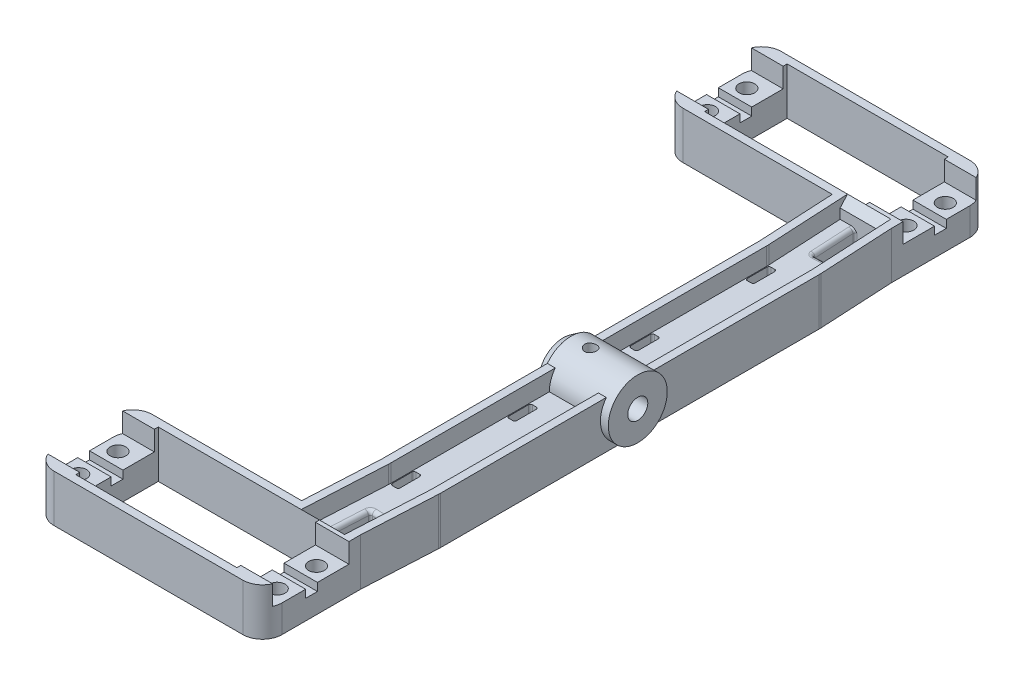
from build123d import *

# Parameters (mm, degrees)
BOSS_EXTRUDE1_DEPTH      = 25
CUT_EXTRUDE2_REACH       = 66.288
SKETCH4_W                = 8
SKETCH4_H                = 18.999999999999968
CUT_EXTRUDE3_DEPTH       = 5
F_4_0MM_DOWEL_HOLE1_D    = 4
CUT_EXTRUDE4_DEPTH       = 2
FILLET2_R                = 5
BOSS_EXTRUDE2_DEPTH      = 12
FILLET9_START            = -1
FILLET9_DEPTH            = 14
FILLET9_2_DEPTH          = 12
SHELL1_T                 = -2
SHELL1_THICKNESS_2_DEPTH = 5.5
BOSS_EXTRUDE3_DEPTH      = 2
BOSS_EXTRUDE3_DEPTH_BACK = 17
SKETCH13_R               = 7.500000000000028
FILLET5_R                = 5
CUT_EXTRUDE5_DEPTH       = 195.0238387415321
CUT_EXTRUDE5_DEPTH_BACK  = 195.0238387415321
CUT_EXTRUDE6_REACH       = 196.024
SKETCH19_W               = 2.0000000000000018
SKETCH19_H               = 6.000000000000028
SKETCH19_W_2             = 2.0000000000000036
FILLET10_R               = 0.5
LPATTERN2_COUNT          = 2
LPATTERN2_PITCH          = 29.657004096578483
FILLET10_OF_LPATTERN2_R  = 0.5
MIRROR4_DEPTH            = 7.5
FILLET8_R                = 0.5
FILLET7_R                = 1
CHAMFER3_SIZE2           = 1.349017034
CHAMFER3_SIZE            = 2
M3_CLEARANCE_HOLE1_D     = 3
M3_CLEARANCE_HOLE1_DEPTH = 4
CHAMFER4_SIZE            = 2


with BuildPart() as part:
    # Sketch1 → Boss-Extrude1 (new body)
    with BuildSketch(Plane.XY):
        Polygon((0, 0), (-57.99999999999999, -7.1e-15), (-57.99999999999999, 11.999999999999993), (0, 12), align=None)
    extrude(amount=BOSS_EXTRUDE1_DEPTH)

    # Sketch2 → Cut-Extrude2 (cut, up to next)
    with BuildSketch(Plane(origin=(-1.44e-15, 12, 0), x_dir=(1, 1.4e-16, 0), z_dir=(-1.4e-16, 1, 0)), mode=Mode.PRIVATE) as cut_extrude2_sk1:
        Polygon((-49.49999999999999, -2.0000000000000027), (-8.499999999999995, -1.9999999999999978), (-8.499999999999991, -23), (-49.49999999999999, -23.000000000000007), align=None)
    cut_extrude2_tool1 = extrude(cut_extrude2_sk1.sketch, amount=-CUT_EXTRUDE2_REACH, mode=Mode.PRIVATE) & part.part
    add(cut_extrude2_tool1.solids().sort_by_distance((-29, 12, 12.5))[0], mode=Mode.SUBTRACT)

    # Sketch4 → Cut-Extrude3 (cut)
    with BuildSketch(Plane(origin=(-1.44e-15, 12, 0), x_dir=(1, 1.4e-16, 0), z_dir=(-1.4e-16, 1, 0))):
        with Locations((-53.49999999999999, -12.500000000000023)):
            Rectangle(SKETCH4_W, SKETCH4_H)
        Polygon((-57.49999999999999, -22.000000000000007), (-57.49999999999999, -3.0000000000000386), (-57.99999999999999, -3.000000000000041), (-57.99999999999999, -21.999999999999957), align=None)
        Polygon((-8.499999999999993, -3.000000000000039), (-49.49999999999999, -3.0000000000000386), (-49.49999999999999, -22.000000000000007), (-8.499999999999993, -22.000000000000007), align=None)
        Polygon((-0.4999999999999929, -3.000000000000039), (-8.499999999999993, -3.000000000000039), (-8.499999999999991, -22.000000000000007), (-0.5, -22.000000000000007), align=None)
        Polygon((1.22e-15, -3.0000000000000155), (-0.4999999999999935, -3.000000000000039), (-0.499999999999997, -22.000000000000007), (1.22e-15, -22), align=None)
    extrude(amount=-CUT_EXTRUDE3_DEPTH, mode=Mode.SUBTRACT)

    # Ø4.0mm Dowel Hole1 (through all)
    with Locations(Plane(origin=(-8.6e-16, 7, 0), x_dir=(1, 1.2e-16, 0), z_dir=(-1.2e-16, 1, 0))):
        with Locations((-54.25, -7.5), (-3.75, -17.5), (-54.25, -17.5), (-3.75, -7.5)):
            Hole(F_4_0MM_DOWEL_HOLE1_D / 2)

    # Sketch8 → Cut-Extrude4 (cut)
    with BuildSketch(Plane(origin=(-8.6e-16, 7, 0), x_dir=(1, 1.2e-16, 0), z_dir=(-1.2e-16, 1, 0))):
        Polygon((-49.49999999999999, -11.000000000000021), (-57.999999999999986, -11.000000000000025), (-57.999999999999986, -14.000000000000018), (-49.49999999999999, -14.000000000000021), align=None)
        Polygon((-8.499999999999993, -11.000000000000021), (1.73e-15, -11.000000000000016), (1.73e-15, -14.000000000000027), (-8.499999999999993, -14.000000000000021), align=None)
    extrude(amount=-CUT_EXTRUDE4_DEPTH, mode=Mode.SUBTRACT)

    # Fillet2
    fillet2_edges = [part.edges().sort_by_distance(p)[0] for p in [
        (-57.99999999999999, 5.999999999999993, 0),
        (-57.99999999999999, 5.999999999999993, 25),
    ]]
    fillet(fillet2_edges, radius=FILLET2_R)


with BuildPart() as body_2:
    # Mirror3: mirrored copy
    add(part.part.mirror(Plane(origin=(3.5302e-13, 0, 92.49999999999986), x_dir=(1, 0, -3.89e-15), z_dir=(-3.89e-15, 0, -1))))


with BuildPart() as body_3:
    # Sketch12 → Boss-Extrude2 (new body)
    with BuildSketch(Plane.XZ):
        Polygon((0, 25), (1.0000000000000009, 44.081136687729476), (0.999999999999987, 140.91886331227093), (0, 160.00000000000014), (-15.0205851899688, 160.00000000000014), (-14.000000000000012, 140.5260744887333), (-13.999999999999998, 44.47392551126714), (-15.020585189968804, 25.000000000000004), align=None)
    extrude(amount=-BOSS_EXTRUDE2_DEPTH)

    # Fillet9: read off the stored shape, not the designer's step
    # Fillet9 outline → Fillet9 (cut)
    with BuildSketch(Plane(origin=(0, 0, 0), x_dir=(1, 0, 0), z_dir=(0, 1, 0)).offset(FILLET9_START)):
        with BuildLine():
            Line((1, -140.918863312), (1, -140.657004097))
            ThreePointArc((1, -140.657004097), (0.99657325, -140.91877358), (0.986295348, -141.180363659))
            Line((0.986295348, -141.180363659), (1, -140.918863312))
        make_face()
        with BuildLine():
            ThreePointArc((0.986295348, -43.819636341), (0.99657325, -44.08122642), (1, -44.342995903))
            Line((1, -44.342995903), (1, -44.081136688))
            Line((1, -44.081136688), (0.986295348, -43.819636341))
        make_face()
    extrude(amount=FILLET9_DEPTH, mode=Mode.SUBTRACT)

    # Fillet9 2 outline → Fillet9 2 (add)
    with BuildSketch(Plane(origin=(0, 0, 0), x_dir=(1, 0, 0), z_dir=(0, 1, 0))):
        with BuildLine():
            ThreePointArc((-14.013704652, -44.212425165), (-14.00342675, -44.474015244), (-14, -44.735784727))
            Line((-14, -44.735784727), (-14, -44.473925511))
            Line((-14, -44.473925511), (-14.013704652, -44.212425165))
        make_face()
        with BuildLine():
            ThreePointArc((-14, -140.264215273), (-14.00342675, -140.525984756), (-14.013704652, -140.787574835))
            Line((-14.013704652, -140.787574835), (-14, -140.526074489))
            Line((-14, -140.526074489), (-14, -140.264215273))
        make_face()
    extrude(amount=FILLET9_2_DEPTH)

    # Shell1
    shell1_openings = [body_3.faces().sort_by_distance(p)[0] for p in [
        (-7.510292595, 6, 160),
        (-7.510292595, 6, 25),
        (-6.644431493, 12, 92.5),
    ]]
    offset(amount=SHELL1_T, openings=shell1_openings, kind=Kind.INTERSECTION)

    # Shell1 thickness 2 face (on inner face of the shell) → Shell1 thickness 2 (add)
    with BuildSketch(Plane(origin=(-6.644424835, 2, 92.500000003), x_dir=(-1, 0, 0), z_dir=(0, -1, 0))):
        with BuildLine():
            ThreePointArc((-5.644424835000002, 48.15700410205445), (-5.641683435008222, 48.36641968793714), (-5.633461113421291, 48.57569175084146))
            Line((-5.633461112690447, 48.57569175612708), (-4.64168014300416, 67.500000003))
            Line((-4.641680143004158, 67.500000003), (6.373415662972964, 67.500000003))
            Line((6.373415662972964, 67.500000003), (5.372020747919282, 48.39224675046343))
            ThreePointArc((5.372020747421289, 48.392246749158566), (5.359687265000976, 48.078338653786176), (5.3555751649999985, 47.76421527394552))
            Line((5.355575164999997, 47.76421527599999), (5.355575165000011, -47.764215269999994))
            ThreePointArc((5.355575165, -47.7642152679455), (5.359687265000976, -48.07833864778618), (5.372020747421289, -48.39224674315855))
            Line((5.372020747919271, -48.39224674446342), (6.373415662972959, -67.49999999700015))
            Line((6.373415662972959, -67.49999999700015), (-4.641680143004157, -67.49999999700015))
            Line((-4.641680143004157, -67.49999999700015), (-5.633461113038267, -48.57569174349038))
            ThreePointArc((-5.63346111342129, -48.575691744841436), (-5.64168343500822, -48.366419681937145), (-5.644424835, -48.157004096054465))
            Line((-5.644424834999986, -48.157004094), (-5.644424835000001, 48.157004099999995))
        make_face()
    extrude(amount=-SHELL1_THICKNESS_2_DEPTH)

    # Sketch13 → Boss-Extrude3 (add, two sides: drawn at the far end of the back side and taken through both)
    with BuildSketch(Plane(origin=(1.0000000000000175, 1.2e-16, -0.3958434052634674), x_dir=(1.2e-16, 0, -1), z_dir=(1, 1.2e-16, 1.2e-16)).offset(-BOSS_EXTRUDE3_DEPTH_BACK)):
        with Locations(Location((-92.89584340526334, 7.5, 0), (0, 0, 180))):
            Circle(SKETCH13_R)
    extrude(amount=BOSS_EXTRUDE3_DEPTH + BOSS_EXTRUDE3_DEPTH_BACK)

    # Sketch15 → Ø5.0mm Dowel Hole2 (revolve, cut)
    with BuildSketch(Plane(origin=(3.000000000003302, 7.5, 92.49999999999986), x_dir=(-3.552e-14, 0, -1), z_dir=(-1.2e-16, 1, 0))):
        Polygon((0, 0), (-1.494e-14, 61.00000000000601), (2.5499999999999803, 61.00000000000601), (2.5499999999999923, 1e-17), align=None)
    revolve(axis=Axis((9.350000000003293, 7.500000000000001, 92.49999999999963), (-1, -1.2e-16, 3.556e-14)), mode=Mode.SUBTRACT)


with BuildPart() as part_1:
    add(part.part)

    # Combine1: union body 3, body 2
    add(body_3.part)
    add(body_2.part)

    # Fillet5
    fillet5_edges = [part_1.edges().sort_by_distance(p)[0] for p in [
        (0, 6, 0),
        (7.1887e-13, 6, 184.99999999999972),
    ]]
    fillet(fillet5_edges, radius=FILLET5_R)

    # Sketch18 → Cut-Extrude5 (cut, two sides: drawn at the far end of the back side and taken through both)
    with BuildSketch(Plane(origin=(-9.2e-16, 7.499999999999999, 0), x_dir=(1, 1.2e-16, 0), z_dir=(-1.2e-16, 1, 0)).offset(-CUT_EXTRUDE5_DEPTH_BACK)):
        Polygon((-5.757890989488038, -25.000000000000004), (-9.262694200480764, -25.00000000000001), (-8.6773988424567, -36.16810072915058), (-5.182195470815693, -35.98492488230033), align=None)
        Polygon((-5.7578909894879615, -159.99999999999903), (-5.182195470815694, -149.0150751176987), (-8.6773988424567, -148.83189927084845), (-9.262694200480764, -159.99999999999903), align=None)
    extrude(amount=CUT_EXTRUDE5_DEPTH + CUT_EXTRUDE5_DEPTH_BACK, mode=Mode.SUBTRACT)

    # Sketch19 → Cut-Extrude6 (cut, up to next)
    with BuildSketch(Plane(origin=(-9.2e-16, 7.499999999999999, 0), x_dir=(1, 1.2e-16, 0), z_dir=(-1.2e-16, 1, 0)), mode=Mode.PRIVATE) as cut_extrude6_sk1:
        with Locations((-2.2000000000000006, -76.9999999999998)):
            Rectangle(SKETCH19_W, SKETCH19_H)
    cut_extrude6_tool1 = extrude(cut_extrude6_sk1.sketch, amount=-CUT_EXTRUDE6_REACH, mode=Mode.PRIVATE) & part_1.part
    # Sketch19 → Cut-Extrude6 (cut, up to next)
    with BuildSketch(Plane(origin=(-9.2e-16, 7.499999999999999, 0), x_dir=(1, 1.2e-16, 0), z_dir=(-1.2e-16, 1, 0)), mode=Mode.PRIVATE) as cut_extrude6_sk2:
        with Locations((-10.799999999999997, -76.9999999999998)):
            Rectangle(SKETCH19_W_2, SKETCH19_H)
    cut_extrude6_tool2 = extrude(cut_extrude6_sk2.sketch, amount=-CUT_EXTRUDE6_REACH, mode=Mode.PRIVATE) & part_1.part
    cut_extrude6_1 = cut_extrude6_tool1.solids().sort_by_distance((-2.2, 7.5, 77))[0]
    add(cut_extrude6_1, mode=Mode.SUBTRACT)
    cut_extrude6_2 = cut_extrude6_tool2.solids().sort_by_distance((-10.8, 7.5, 77))[0]
    add(cut_extrude6_2, mode=Mode.SUBTRACT)
    cut_extrude6 = cut_extrude6_1 + cut_extrude6_2  # Cut-Extrude6 as one shape, for the pattern or mirror that repeats it

    # Fillet10
    fillet10_edges = [part_1.edges().sort_by_distance(p)[0] for p in [
        (-11.799999999999999, 3.749999999999998, 79.99999999999982),
        (-11.799999999999999, 3.749999999999998, 73.99999999999979),
        (-9.799999999999997, 3.7499999999999987, 73.99999999999979),
        (-9.799999999999997, 3.7499999999999987, 79.99999999999982),
        (-3.200000000000002, 3.7499999999999996, 79.99999999999982),
        (-3.200000000000002, 3.7499999999999996, 73.99999999999979),
        (-1.2000000000000002, 3.7499999999999996, 73.99999999999979),
        (-1.2000000000000002, 3.7499999999999996, 79.99999999999982),
    ]]
    fillet(fillet10_edges, radius=FILLET10_R)

    # LPattern2: Cut-Extrude6 ×2
    with Locations(*[(0, 0, -i * LPATTERN2_PITCH) for i in range(1, LPATTERN2_COUNT)]):
        add(cut_extrude6, mode=Mode.SUBTRACT)

    # Fillet10 of LPattern2
    fillet10_of_lpattern2_edges = [part_1.edges().sort_by_distance(p)[0] for p in [
        (-11.799999999999999, 3.749999999999998, 50.34299590342133),
        (-11.799999999999999, 3.749999999999998, 44.342995903421304),
        (-9.799999999999997, 3.7499999999999987, 44.342995903421304),
        (-9.799999999999997, 3.7499999999999987, 50.34299590342133),
        (-3.200000000000002, 3.7499999999999996, 50.34299590342133),
        (-3.200000000000002, 3.7499999999999996, 44.342995903421304),
        (-1.2000000000000002, 3.7499999999999996, 44.342995903421304),
        (-1.2000000000000002, 3.7499999999999996, 50.34299590342133),
    ]]
    fillet(fillet10_of_lpattern2_edges, radius=FILLET10_OF_LPATTERN2_R)

    # Mirror4: read off the stored shape, not the designer's step
    # Mirror4 outline → Mirror4 (cut)
    with BuildSketch(Plane(origin=(0, 0, 0), x_dir=(1, 0, 0), z_dir=(0, 1, 0))):
        with BuildLine():
            ThreePointArc((-2.7, -105), (-3.053553391, -105.146446609), (-3.2, -105.5))
            Line((-3.2, -105.5), (-3.2, -110.5))
            ThreePointArc((-3.2, -110.5), (-3.053553391, -110.853553391), (-2.7, -111))
            Line((-2.7, -111), (-1.7, -111))
            ThreePointArc((-1.7, -111), (-1.346446609, -110.853553391), (-1.2, -110.5))
            Line((-1.2, -110.5), (-1.2, -105.5))
            ThreePointArc((-1.2, -105.5), (-1.346446609, -105.146446609), (-1.7, -105))
            Line((-1.7, -105), (-2.7, -105))
        make_face()
        with BuildLine():
            ThreePointArc((-2.7, -134.657004097), (-3.053553391, -134.803450706), (-3.2, -135.157004097))
            Line((-3.2, -135.157004097), (-3.2, -140.157004097))
            ThreePointArc((-3.2, -140.157004097), (-3.053553391, -140.510557487), (-2.7, -140.657004097))
            Line((-2.7, -140.657004097), (-1.7, -140.657004097))
            ThreePointArc((-1.7, -140.657004097), (-1.346446609, -140.510557487), (-1.2, -140.157004097))
            Line((-1.2, -140.157004097), (-1.2, -135.157004097))
            ThreePointArc((-1.2, -135.157004097), (-1.346446609, -134.803450706), (-1.7, -134.657004097))
            Line((-1.7, -134.657004097), (-2.7, -134.657004097))
        make_face()
        with BuildLine():
            ThreePointArc((-11.3, -105), (-11.653553391, -105.146446609), (-11.8, -105.5))
            Line((-11.8, -105.5), (-11.8, -110.5))
            ThreePointArc((-11.8, -110.5), (-11.653553391, -110.853553391), (-11.3, -111))
            Line((-11.3, -111), (-10.3, -111))
            ThreePointArc((-10.3, -111), (-9.946446609, -110.853553391), (-9.8, -110.5))
            Line((-9.8, -110.5), (-9.8, -105.5))
            ThreePointArc((-9.8, -105.5), (-9.946446609, -105.146446609), (-10.3, -105))
            Line((-10.3, -105), (-11.3, -105))
        make_face()
        with BuildLine():
            ThreePointArc((-11.3, -134.657004097), (-11.653553391, -134.803450706), (-11.8, -135.157004097))
            Line((-11.8, -135.157004097), (-11.8, -140.157004097))
            ThreePointArc((-11.8, -140.157004097), (-11.653553391, -140.510557487), (-11.3, -140.657004097))
            Line((-11.3, -140.657004097), (-10.3, -140.657004097))
            ThreePointArc((-10.3, -140.657004097), (-9.946446609, -140.510557487), (-9.8, -140.157004097))
            Line((-9.8, -140.157004097), (-9.8, -135.157004097))
            ThreePointArc((-9.8, -135.157004097), (-9.946446609, -134.803450706), (-10.3, -134.657004097))
            Line((-10.3, -134.657004097), (-11.3, -134.657004097))
        make_face()
    extrude(amount=MIRROR4_DEPTH, mode=Mode.SUBTRACT)

    # Fillet8
    fillet8_edges = [part_1.edges().sort_by_distance(p)[0] for p in [
        (-8.6773988424567, 3.75, 148.83189927084845),
        (-5.182195470815694, 3.75, 149.0150751176987),
        (-5.7578909894879615, 3.75, 159.99999999999903),
        (-9.262694200480764, 3.75, 159.99999999999903),
        (-8.6773988424567, 3.75, 36.16810072915058),
        (-9.262694200480764, 3.75, 25.00000000000001),
        (-5.757890989488038, 3.75, 25.000000000000004),
        (-5.182195470815693, 3.75, 35.98492488230033),
    ]]
    fillet(fillet8_edges, radius=FILLET8_R)

    # Fillet7
    # the kernel refuses this fillet: 1 mm, written as the material it takes off along each edge
    with BuildSketch(Plane(origin=(-9.235118905217574, 7.5, 159.47383202187757), x_dir=(-0.998629534754574, 0, -0.052335956242941066), z_dir=(0.052335956242941066, 0, -0.998629534754574))) as fillet7_piece_1:
        with BuildLine():
            CenterArc((FILLET7_R, -FILLET7_R), FILLET7_R, 90, 90)
            Line((0, -FILLET7_R), (0, 0))
            Line((0, 0), (FILLET7_R, 0))
        make_face()
    extrude(amount=10.156537164850135, mode=Mode.SUBTRACT)
    with BuildSketch(Plane(origin=(-8.178084075079422, 7.5, 148.85806724896992), x_dir=(0.05233595624292783, 0, -0.9986295347545747), z_dir=(0.9986295347545748, 0, 0.052335956242927834))) as fillet7_piece_2:
        with BuildLine():
            CenterArc((FILLET7_R, -FILLET7_R), FILLET7_R, 90, 90)
            Line((0, -FILLET7_R), (0, 0))
            Line((0, 0), (FILLET7_R, 0))
        make_face()
    extrude(amount=2.5000000000000018, mode=Mode.SUBTRACT)
    with BuildSketch(Plane(origin=(-5.208363448937161, 7.5, 149.51438988507599), x_dir=(0.9986295347545745, 0, 0.052335956242933336), z_dir=(-0.052335956242933336, 0, 0.9986295347545745))) as fillet7_piece_3:
        with BuildLine():
            CenterArc((FILLET7_R, -FILLET7_R), FILLET7_R, 90, 90)
            Line((0, -FILLET7_R), (0, 0))
            Line((0, 0), (FILLET7_R, 0))
        make_face()
    extrude(amount=10.02551771664257, mode=Mode.SUBTRACT)
    with BuildSketch(Plane(origin=(-5.6815102381929865, 7.5, 36.0110928604218), x_dir=(0.052335956242929846, 0, 0.9986295347545746), z_dir=(-0.9986295347545746, 0, 0.052335956242929846))) as fillet7_piece_4:
        with BuildLine():
            CenterArc((FILLET7_R, -FILLET7_R), FILLET7_R, 90, 90)
            Line((-5e-17, -FILLET7_R), (0, 0))
            Line((0, 0), (FILLET7_R, 0))
        make_face()
    extrude(amount=2.4999999999999956, mode=Mode.SUBTRACT)
    with BuildSketch(Plane(origin=(-8.703566820578171, 7.5, 35.66878596177331), x_dir=(0, -1, 0), z_dir=(-0.052335956242941115, 0, -0.998629534754574))) as fillet7_piece_5:
        with BuildLine():
            CenterArc((FILLET7_R, FILLET7_R), FILLET7_R, 180, 90)
            Line((0, FILLET7_R), (0, 0))
            Line((0, 0), (FILLET7_R, 0))
        make_face()
    extrude(amount=10.156537164850137, mode=Mode.SUBTRACT)
    with BuildSketch(Plane(origin=(-5.733058505468193, 7.5, 25.47383202187853), x_dir=(0.998629534754574, 0, -0.05233595624294038), z_dir=(0.052335956242940386, 0, 0.998629534754574))) as fillet7_piece_6:
        with BuildLine():
            CenterArc((FILLET7_R, -FILLET7_R), FILLET7_R, 90, 90)
            Line((-1.9e-16, -FILLET7_R), (0, 0))
            Line((0, 0), (FILLET7_R, 0))
        make_face()
    extrude(amount=10.025517716642574, mode=Mode.SUBTRACT)
    with BuildSketch(Plane(origin=(-8.204252053200886, 7.5, 149.3573820163472), x_dir=(-0.9986295347545747, 0, -0.05233595624292778), z_dir=(-0.05233595624292778, 0, 0.9986295347545747))) as fillet7_piece_7:
        with BuildLine():
            CenterArc((0.4999999999999962 + FILLET7_R, FILLET7_R), FILLET7_R, 180, 90)
            Line((0.5000000000000032, FILLET7_R), (0.4999999999999962, 0))
            Line((0.4999999999999962, 0), (0.4999999999999962 + FILLET7_R, 0))
        make_face()
    revolve(axis=Axis((-8.204252053200886, 7.5, 149.3573820163472), (1.2e-16, -1, 0)), revolution_arc=90, mode=Mode.SUBTRACT)
    with BuildSketch(Plane(origin=(-5.707678216314448, 7.5, 149.48822190695452), x_dir=(0.9986295347545747, 0, 0.05233595624292778), z_dir=(-0.05233595624292778, 0, 0.9986295347545747))) as fillet7_piece_8:
        with BuildLine():
            CenterArc((0.4999999999999971 + FILLET7_R, -FILLET7_R), FILLET7_R, 90, 90)
            Line((0.49999999999999534, -FILLET7_R), (0.4999999999999971, 0))
            Line((0.4999999999999971, 0), (0.4999999999999971 + FILLET7_R, 0))
        make_face()
    revolve(axis=Axis((-5.707678216314448, 7.5, 149.48822190695452), (-1.2e-16, 1, 0)), revolution_arc=89.99999999999997, mode=Mode.SUBTRACT)
    with BuildSketch(Plane(origin=(-8.204252053200884, 7.5, 35.64261798365183), x_dir=(0.052335956242931504, 0, 0.9986295347545745), z_dir=(0.9986295347545745, 0, -0.052335956242931504))) as fillet7_piece_9:
        with BuildLine():
            CenterArc((0.5000000000000052 + FILLET7_R, FILLET7_R), FILLET7_R, 180, 90)
            Line((0.49999999999999833, FILLET7_R), (0.5000000000000052, 0))
            Line((0.5000000000000052, 0), (0.5000000000000052 + FILLET7_R, 0))
        make_face()
    revolve(axis=Axis((-8.204252053200884, 7.5, 35.64261798365183), (1.2e-16, -1, 0)), revolution_arc=89.99999999999852, mode=Mode.SUBTRACT)
    with BuildSketch(Plane(origin=(-5.707678216314451, 7.5, 35.51177809304451), x_dir=(0.9986295347545747, 0, -0.05233595624292778), z_dir=(-0.05233595624292778, 0, -0.9986295347545747))) as fillet7_piece_10:
        with BuildLine():
            CenterArc((0.499999999999998 + FILLET7_R, FILLET7_R), FILLET7_R, 180, 90)
            Line((0.49999999999999956, FILLET7_R), (0.499999999999998, 0))
            Line((0.499999999999998, 0), (0.499999999999998 + FILLET7_R, 0))
        make_face()
    revolve(axis=Axis((-5.707678216314451, 7.5, 35.51177809304451), (1.2e-16, -1, 0)), revolution_arc=89.9999999999999, mode=Mode.SUBTRACT)
    with BuildSketch(Plane(origin=(-8.735804137840287, 7.5, 159.49999999999903), x_dir=(-0.9982809883148718, 0, -0.05860945631110309), z_dir=(-0.05860945631110309, 0, 0.9982809883148718))) as fillet7_piece_11_section:
        with BuildLine():
            CenterArc((0.500000000000007 + FILLET7_R, FILLET7_R), FILLET7_R, 180, 90)
            Line((0.500000000000007, FILLET7_R), (0.500000000000007, 0))
            Line((0.500000000000007, 0), (0.500000000000007 + FILLET7_R, 0))
        make_face()
    fillet7_piece_11 = revolve(axis=Axis((-8.735804137840287, 7.5, 159.49999999999903), (1.2e-16, -1, 0)), revolution_arc=359.63999999999993, mode=Mode.PRIVATE)
    fillet7_piece_11 = split(fillet7_piece_11, bisect_by=Plane(origin=(-8.735804137840287, 7.5, 159.99999999999903), z_dir=(0, 0, -1)), keep=Keep.TOP, mode=Mode.PRIVATE)
    add(fillet7_piece_11, mode=Mode.SUBTRACT)
    with BuildSketch(Plane(origin=(-6.2323732728454075, 7.5, 159.49999999999903), x_dir=(0.9989386570101715, 0, 0.04606039004085005), z_dir=(-0.04606039004085005, 0, 0.9989386570101715))) as fillet7_piece_12_section:
        with BuildLine():
            CenterArc((0.49999999999999484 + FILLET7_R, -FILLET7_R), FILLET7_R, 90, 90)
            Line((0.49999999999999306, -FILLET7_R), (0.49999999999999484, 0))
            Line((0.49999999999999484, 0), (0.49999999999999484 + FILLET7_R, 0))
        make_face()
    fillet7_piece_12 = revolve(axis=Axis((-6.2323732728454075, 7.5, 159.49999999999903), (-1.2e-16, 1, 0)), revolution_arc=359.6400000000001, mode=Mode.PRIVATE)
    fillet7_piece_12 = split(fillet7_piece_12, bisect_by=Plane(origin=(-6.2323732728454075, 7.5, 159.99999999999903), z_dir=(0, 0, -1)), keep=Keep.TOP, mode=Mode.PRIVATE)
    add(fillet7_piece_12, mode=Mode.SUBTRACT)
    with BuildSketch(Plane(origin=(-8.735804137840285, 7.5, 25.50000000000001), x_dir=(-0.9982809883148724, 0, 0.058609456311089124), z_dir=(-0.058609456311089124, 0, -0.9982809883148724))) as fillet7_piece_13_section:
        with BuildLine():
            CenterArc((0.5000000000000011 + FILLET7_R, -FILLET7_R), FILLET7_R, 90, 90)
            Line((0.5000000000000029, -FILLET7_R), (0.5000000000000011, 0))
            Line((0.5000000000000011, 0), (0.5000000000000011 + FILLET7_R, 0))
        make_face()
    fillet7_piece_13 = revolve(axis=Axis((-8.735804137840285, 7.5, 25.50000000000001), (-1.2e-16, 1, 0)), revolution_arc=359.64000000000004, mode=Mode.PRIVATE)
    fillet7_piece_13 = split(fillet7_piece_13, bisect_by=Plane(origin=(-8.735804137840287, 7.5, 25.00000000000001), z_dir=(2.03e-15, 0, 1)), keep=Keep.TOP, mode=Mode.PRIVATE)
    add(fillet7_piece_13, mode=Mode.SUBTRACT)
    with BuildSketch(Plane(origin=(-6.2323732728454795, 7.5, 25.5), x_dir=(0.9986295347545737, 0, -0.052335956242949046), z_dir=(0.052335956242949046, 0, 0.9986295347545737))) as fillet7_piece_14_section:
        with BuildLine():
            CenterArc((0.5000000000000012 + FILLET7_R, -FILLET7_R), FILLET7_R, 90, 90)
            Line((0.5000000000000039, -FILLET7_R), (0.5000000000000012, 0))
            Line((0.5000000000000012, 0), (0.5000000000000012 + FILLET7_R, 0))
        make_face()
    fillet7_piece_14 = revolve(axis=Axis((-6.2323732728454795, 7.5, 25.5), (-1.2e-16, 1, 0)), revolution_arc=359.64, mode=Mode.PRIVATE)
    fillet7_piece_14 = split(fillet7_piece_14, bisect_by=Plane(origin=(-6.23237327284548, 7.5, 25.000000000000004), z_dir=(2.03e-15, 0, 1)), keep=Keep.TOP, mode=Mode.PRIVATE)
    add(fillet7_piece_14, mode=Mode.SUBTRACT)

    # Chamfer3
    chamfer3_edges = [part_1.edges().sort_by_distance(p)[0] for p in [
        (-15.999999999999993, 7.4999999999999964, 84.99999999999984),
    ]]
    chamfer3_side = [part_1.faces().sort_by_distance(p)[0] for p in [
        (-15.973019659326296, 7.4999999999999964, 84.99999999999984),
    ]]
    chamfer(chamfer3_edges, length=CHAMFER3_SIZE - 0.0001, length2=CHAMFER3_SIZE2 - 0.0001, reference=chamfer3_side[0])  # a hair under: the kernel refuses the full size

    # M3 Clearance Hole1
    with Locations(Plane(origin=(-9, 15, 92.5), x_dir=(0, 0, 1), z_dir=(0, 1, 0))):
        with Locations((0, 0)):
            Hole(M3_CLEARANCE_HOLE1_D / 2, depth=M3_CLEARANCE_HOLE1_DEPTH)

    # Chamfer4
    chamfer4_edges = [part_1.edges().sort_by_distance(p)[0] for p in [
        (-7.510292594984403, 12, 25),
        (-7.510292594984402, 12, 160.00000000000014),
    ]]
    chamfer(chamfer4_edges, length=CHAMFER4_SIZE - 0.0001)  # a hair under: the kernel refuses the full size


solid = part_1.part
